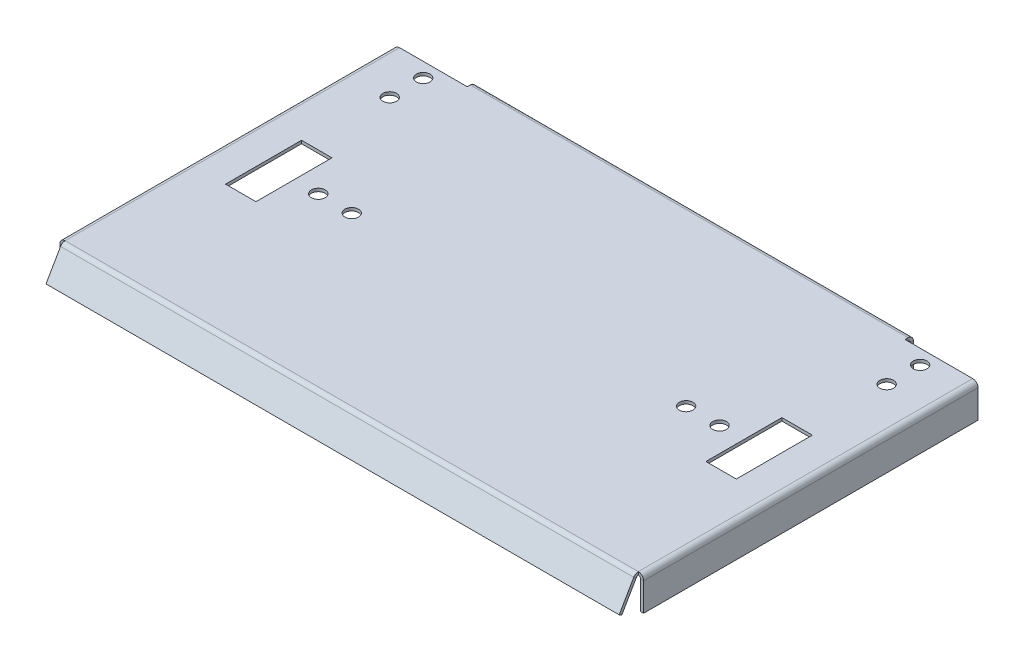
from build123d import *

# Parameters (mm, degrees)
SKETCH1_W                    = 190
SKETCH1_H                    = 110
BASE_FLANGE1_DEPTH           = 1
EDGE_FLANGE1_START           = -72
EDGE_FLANGE1_DEPTH           = 144
EDGE_FLANGE2_STRIP_W         = 5.4732
EDGE_FLANGE2_STRIP_H         = 1
EDGE_FLANGE2_STRIP_CUT_DEPTH = 110
EDGE_FLANGE2_DEPTH           = 110
EDGE_FLANGE3_DEPTH           = 188.5268
SKETCH17_R                   = 2.25
SKETCH17_W                   = 10
SKETCH17_H                   = 25
CUT_EXTRUDE1_DEPTH           = 115.427372832
SKETCH18_R                   = 2.25
CUT_EXTRUDE2_DEPTH           = 115.427372832


# Read off the part's stored shape, not the designer's step: Edge-Flange1
# Sheet-metal steps are written as plain solids
with BuildPart() as part:
    # Sketch1 → Base-Flange1 (new body)
    with BuildSketch(Plane(origin=(0, 0, 0), x_dir=(1, 0, 0), z_dir=(0, 1, 0))):
        Rectangle(SKETCH1_W, SKETCH1_H)
    extrude(amount=-BASE_FLANGE1_DEPTH)

    # Edge-Flange1 outline → Edge-Flange1 (add)
    with BuildSketch(Plane.YZ.offset(EDGE_FLANGE1_START)):
        with BuildLine():
            Line((-11, -57.7366), (-1.7366, -57.7366))
            ThreePointArc((-1.7366, -57.7366), (-0.508638364, -57.227961636), (0, -56))
            Line((0, -56), (0, -55))
            Line((0, -55), (-1, -55))
            Line((-1, -55), (-1, -56))
            ThreePointArc((-1, -56), (-1.215745145, -56.520854855), (-1.7366, -56.7366))
            Line((-1.7366, -56.7366), (-11, -56.7366))
            Line((-11, -56.7366), (-11, -57.7366))
        make_face()
    extrude(amount=EDGE_FLANGE1_DEPTH)

    # Edge-Flange2 strip (across the edge) → Edge-Flange2 strip cut (cut)
    with BuildSketch(Plane(origin=(-95, -1, 55), x_dir=(1, 0, 0), z_dir=(0, 0, -1))):
        with Locations((-2, -0.5)):
            Rectangle(EDGE_FLANGE2_STRIP_W, EDGE_FLANGE2_STRIP_H)
    edge_flange2_strip_cut = extrude(amount=EDGE_FLANGE2_STRIP_CUT_DEPTH, mode=Mode.SUBTRACT)

    # Edge-Flange2 section (across the edge) → Edge-Flange2 (add)
    with BuildSketch(Plane(origin=(-95, -1, 55), x_dir=(1, 0, 0), z_dir=(0, 0, -1))):
        with BuildLine():
            Line((-1, 0.7366), (-1, 10))
            Line((-1, 10), (0, 10))
            Line((0, 10), (0, 0.7366))
            ThreePointArc((0, 0.7366), (0.215745145, 0.215745145), (0.7366, 0))
            Line((0.7366, 0), (0.7366, -1))
            ThreePointArc((0.7366, -1), (-0.491361636, -0.491361636), (-1, 0.7366))
        make_face()
    edge_flange2 = extrude(amount=EDGE_FLANGE2_DEPTH)

    # Mirror1: Edge-Flange2 strip cut, Edge-Flange2 across plane
    add(edge_flange2_strip_cut.mirror(Plane(origin=(0, 0, 0), x_dir=(0, 0, 1), z_dir=(1, 0, 0))), mode=Mode.SUBTRACT)
    add(edge_flange2.mirror(Plane(origin=(0, 0, 0), x_dir=(0, 0, 1), z_dir=(1, 0, 0))))

    # Edge-Flange3 section (across the edge) → Edge-Flange3 (add)
    with BuildSketch(Plane(origin=(94.2634, -1, 55.425276208), x_dir=(0, -0.5000000000000041, -0.8660254037844364), z_dir=(-1, 0, 0))):
        with BuildLine():
            Line((-1, 0.425276208), (-1, 10))
            Line((-1, 10), (0, 10))
            Line((0, 10), (0, 0.425276208))
            ThreePointArc((0, 0.425276208), (0.098685688, 0.056976208), (0.3683, -0.212638104))
            Line((0.3683, -0.212638104), (-0.1317, -1.078663508))
            ThreePointArc((-0.1317, -1.078663508), (-0.767339716, -0.443023792), (-1, 0.425276208))
        make_face()
    extrude(amount=EDGE_FLANGE3_DEPTH)

    # Sketch17 → Cut-Extrude1 (cut, through all)
    with BuildSketch(Plane(origin=(0, 0, 0), x_dir=(1, 0, 0), z_dir=(0, 1, 0))):
        with Locations(Location((66, 0, 0), (0, 0, 270))):
            Circle(SKETCH17_R)
        with Locations(Location((55, 0, 0), (0, 0, 270))):
            Circle(SKETCH17_R)
        with Locations(Location((-55, 0, 0), (0, 0, 270))):
            Circle(SKETCH17_R)
        with Locations(Location((-66, 0, 0), (0, 0, 270))):
            Circle(SKETCH17_R)
        with Locations((79, 0)):
            Rectangle(SKETCH17_W, SKETCH17_H)
        with Locations((-79, 0)):
            Rectangle(SKETCH17_W, SKETCH17_H)
    extrude(amount=-CUT_EXTRUDE1_DEPTH, mode=Mode.SUBTRACT)

    # Sketch18 → Cut-Extrude2 (cut, through all)
    with BuildSketch(Plane(origin=(0, 0, 0), x_dir=(1, 0, 0), z_dir=(0, 1, 0))):
        with Locations(Location((81.73, 50.2366, 0), (0, 0, 270))):
            Circle(SKETCH18_R)
        with Locations(Location((81.73, 39.2366, 0), (0, 0, 270))):
            Circle(SKETCH18_R)
        with Locations(Location((-81.73, 39.2366, 0), (0, 0, 270))):
            Circle(SKETCH18_R)
        with Locations(Location((-81.73, 50.2366, 0), (0, 0, 270))):
            Circle(SKETCH18_R)
    extrude(amount=-CUT_EXTRUDE2_DEPTH, mode=Mode.SUBTRACT)


solid = part.part
